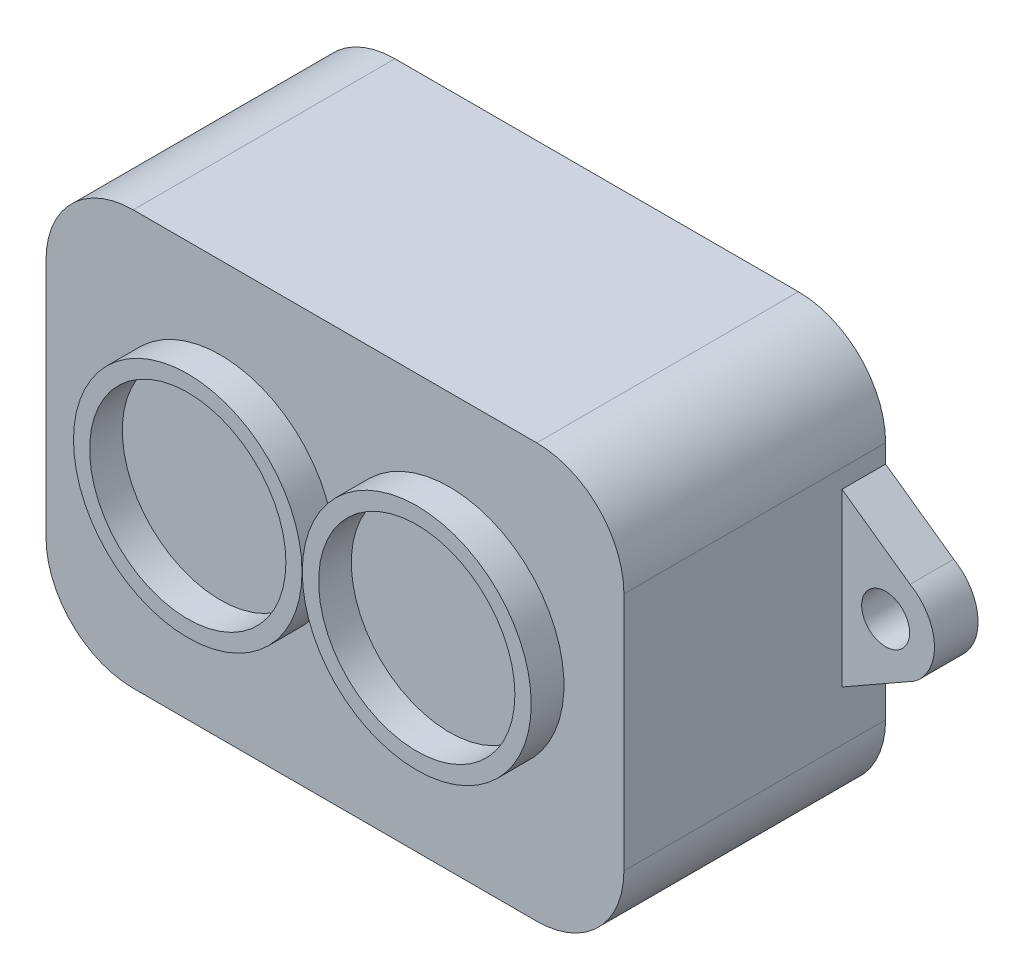
from build123d import *

# Parameters (mm, degrees)
SKETCH_1_W          = 26.5
SKETCH_1_H          = 19
EXTRUDE_1_DEPTH     = 12
SKETCH_2_R          = 5.25
SKETCH_2_R_2        = 4.5
EXTRUDE_6_DEPTH     = 1.5
FILLET_1_R          = 4
SKETCH_3_R          = 1.1
EXTRUDE_7_DEPTH     = 2
SKETCH_4_R          = 5.24
SKETCH_4_R_2        = 4.5
EXTRUDE_11_DEPTH    = 1.5
SKETCH_5_W          = 18
SKETCH_5_H          = 4.5
EXTRUDE_12_DEPTH    = 8.8
FILLET_2_R          = 2
FILLET_3_R          = 1
SKETCH_6_W          = 10.5
SKETCH_6_H          = 6.8
CUT_EXTRUDE_1_DEPTH = 5
FILLET_4_R          = 1


with BuildPart() as part:
    # 草图1 → 凸台-拉伸1 (new body)
    with BuildSketch(Plane.XY):
        Rectangle(SKETCH_1_W, SKETCH_1_H)
    extrude(amount=EXTRUDE_1_DEPTH)

    # 草图2 → 凸台-拉伸6 (add)
    with BuildSketch(Plane.XY.offset(12)):
        with Locations(Location((5.25, 0.5, 0), (0, 0, 180))):
            Circle(SKETCH_2_R)
        with Locations((5.25, 0.5)):
            Circle(SKETCH_2_R_2, mode=Mode.SUBTRACT)
    extrude(amount=EXTRUDE_6_DEPTH)

    # 圆角1
    fillet_1_edges = [part.edges().sort_by_distance(p)[0] for p in [
        (13.25, -9.5, 6),
        (-13.25, -9.5, 6),
        (-13.25, 9.5, 6),
        (13.25, 9.5, 6),
    ]]
    fillet(fillet_1_edges, radius=FILLET_1_R)


with BuildPart() as body_2:
    # 草图3 → 凸台-拉伸7 (new body)
    with BuildSketch(Plane(origin=(0, 0, 0), x_dir=(-1, 0, 0), z_dir=(0, 0, -1))):
        with BuildLine():
            Line((-13.25, -3.197389306), (-13.25, 0.5))
            Line((-13.25, 0.5), (-13.25, 4.65411399))
            Line((-13.25, 4.65411399), (-16.373409728, 2.437537425))
            ThreePointArc((-16.373409728, 2.437537425), (-17.486318468, 0.622394439), (-16.578150415, -1.303362738))
            Line((-16.578150415, -1.303362738), (-13.25, -3.197389306))
        make_face()
        with Locations((-15.25, 0.5)):
            Circle(SKETCH_3_R, mode=Mode.SUBTRACT)
    extrude_7 = extrude(amount=-EXTRUDE_7_DEPTH)


with BuildPart() as part_1:
    add(part.part)

    # 镜向3: 凸台-拉伸7 across plane
    add(extrude_7.mirror(Plane(origin=(0, 0, 0), x_dir=(0, 0, 1), z_dir=(1, 0, 0))))

    # 草图4 → 凸台-拉伸11 (add)
    with BuildSketch(Plane.XY.offset(12)):
        with Locations(Location((-5.25, 0.5, 0), (0, 0, 180))):
            Circle(SKETCH_4_R)
        with Locations((-5.25, 0.5)):
            Circle(SKETCH_4_R_2, mode=Mode.SUBTRACT)
    extrude(amount=EXTRUDE_11_DEPTH)

    # 草图5 → 凸台-拉伸12 (add)
    with BuildSketch(Plane(origin=(0, 0, 0), x_dir=(-1, 0, 0), z_dir=(0, 0, -1))):
        with Locations((0, -9.5)):
            Rectangle(SKETCH_5_W, SKETCH_5_H)
    extrude(amount=-EXTRUDE_12_DEPTH)

    # 圆角2
    fillet_2_edges = [part_1.edges().sort_by_distance(p)[0] for p in [
        (9, -10.625, 8.8),
        (-9, -10.625, 8.8),
    ]]
    fillet(fillet_2_edges, radius=FILLET_2_R)

    # 圆角3
    # the kernel refuses this fillet: 1 mm, written as the material it takes off along each edge
    with BuildSketch(Plane(origin=(-9, -11.75, -2.5), x_dir=(0, 1, 0), z_dir=(0, 0, 1))) as fillet_3_piece_1:
        with BuildLine():
            CenterArc((FILLET_3_R, -FILLET_3_R), FILLET_3_R, 90, 90)
            Line((0, -FILLET_3_R), (0, 0))
            Line((0, 0), (FILLET_3_R, 0))
        make_face()
    extrude(amount=11.8, mode=Mode.SUBTRACT)
    with BuildSketch(Plane(origin=(9, -11.75, -2.5), x_dir=(0, 1, 0), z_dir=(0, 0, 1))) as fillet_3_piece_2:
        with BuildLine():
            CenterArc((FILLET_3_R, FILLET_3_R), FILLET_3_R, 180, 90)
            Line((0, FILLET_3_R), (0, 0))
            Line((0, 0), (FILLET_3_R, 0))
        make_face()
    extrude(amount=11.8, mode=Mode.SUBTRACT)

    # 草图6 → 切除-拉伸1 (cut)
    with BuildSketch(Plane.XZ.offset(11.75)):
        with Locations((0, 3.4)):
            Rectangle(SKETCH_6_W, SKETCH_6_H)
    extrude(amount=-CUT_EXTRUDE_1_DEPTH, mode=Mode.SUBTRACT)

    # 圆角4
    fillet_4_edges = [part_1.edges().sort_by_distance(p)[0] for p in [
        (-5.25, -9.25, 6.8),
        (5.25, -9.25, 6.8),
    ]]
    fillet(fillet_4_edges, radius=FILLET_4_R)


solid = Compound([body_2.part, part_1.part])
